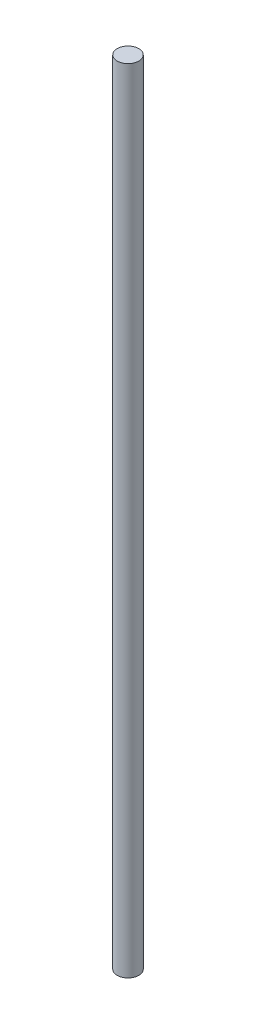
from build123d import *

# Parameters (mm, degrees)
SKETCH2_R           = 6
BOSS_EXTRUDE1_DEPTH = 440


with BuildPart() as part:
    # Sketch2 → Boss-Extrude1 (new body)
    with BuildSketch(Plane(origin=(0, 0, 0), x_dir=(1, 0, 0), z_dir=(0, 1, 0))):
        Circle(SKETCH2_R)
    extrude(amount=BOSS_EXTRUDE1_DEPTH)


solid = part.part
